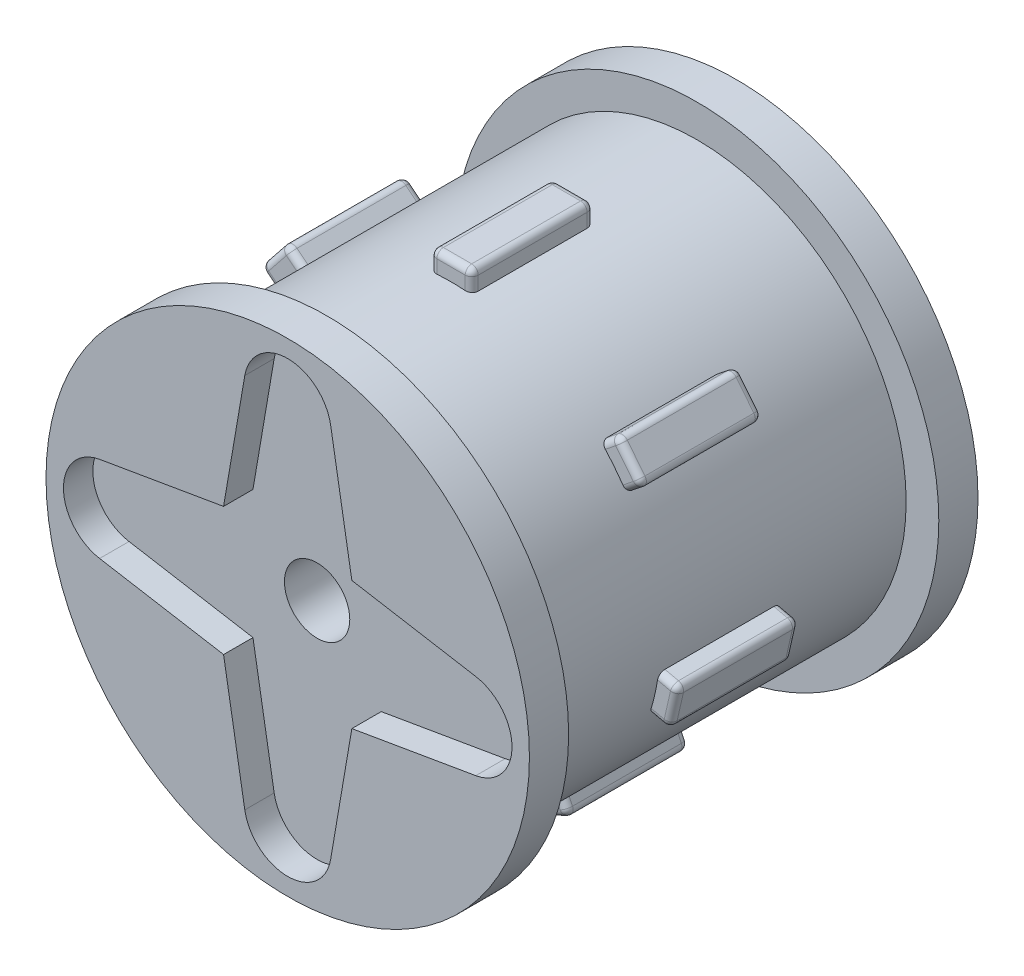
from build123d import *

# Parameters (mm, degrees)
AUFSATZ_LINEAR_AUSTRAGEN1_DEPTH      = 10.3
AUFSATZ_LINEAR_AUSTRAGEN1_DEPTH_BACK = 10.3
SKIZZE1_R                            = 9.6
SKIZZE2_R                            = 11.1
AUFSATZ_LINEAR_AUSTRAGEN2_DEPTH      = 1.8
AUFSATZ_LINEAR_START                 = -1.8
SKIZZE3_R                            = 11.1
AUFSATZ_LINEAR_AUSTRAGEN3_DEPTH      = 1.8
SCHNITT_LINEAR_AUSTRAGEN1_DEPTH      = 1.35
KREISMUSTER1_COUNT                   = 4
SKIZZE9_R                            = 1.5
SCHNITT_LINEAR_AUSTRAGEN2_DEPTH      = 25.839132433
SKIZZE11_W                           = 1.9
SKIZZE11_H                           = 1.78
AUFSATZ_LINEAR_AUSTRAGEN4_DEPTH      = 2.8
KREISMUSTER2_COUNT                   = 7
VERRUNDUNG1_R                        = 0.3


with BuildPart() as part:
    # Skizze1 → Aufsatz-Linear austragen1 (new, two sides: drawn at the far end of the back side and taken through both)
    with BuildSketch(Plane.XY.offset(-AUFSATZ_LINEAR_AUSTRAGEN1_DEPTH_BACK)):
        Circle(SKIZZE1_R)
    extrude(amount=AUFSATZ_LINEAR_AUSTRAGEN1_DEPTH + AUFSATZ_LINEAR_AUSTRAGEN1_DEPTH_BACK)

    # Skizze2 → Aufsatz-Linear austragen2 (add)
    with BuildSketch(Plane.XY.offset(10.3)):
        Circle(SKIZZE2_R)
    extrude(amount=-AUFSATZ_LINEAR_AUSTRAGEN2_DEPTH)

    # Skizze3 → Aufsatz-Linear austragen3 (add)
    with BuildSketch(Plane(origin=(0, 0, -10.3), x_dir=(-1, 0, 0), z_dir=(0, 0, -1)).offset(AUFSATZ_LINEAR_START)):
        Circle(SKIZZE3_R)
    extrude(amount=AUFSATZ_LINEAR_AUSTRAGEN3_DEPTH)

    # Skizze4 → Schnitt-Linear austragen1 (cut)
    with BuildSketch(Plane.XY.offset(10.3)):
        with BuildLine():
            Line((-1.971343548, 8.637349398), (-3.351284031, 0.573493976))
            ThreePointArc((-3.351284031, 0.573493976), (0, -3.4), (3.351284031, 0.573493976))
            Line((3.351284031, 0.573493976), (1.971343548, 8.637349398))
            ThreePointArc((1.971343548, 8.637349398), (0, 10.3), (-1.971343548, 8.637349398))
        make_face()
    schnitt_linear_austragen1 = extrude(amount=-SCHNITT_LINEAR_AUSTRAGEN1_DEPTH, mode=Mode.SUBTRACT)

    # Kreismuster1: Schnitt-Linear austragen1 ×4 about axis
    kreismuster1_axis = Axis((0, 0, -10.3), (0, 0, 1))
    for i in range(1, KREISMUSTER1_COUNT):
        add(schnitt_linear_austragen1.rotate(kreismuster1_axis, i * 360 / KREISMUSTER1_COUNT), mode=Mode.SUBTRACT)

    # Skizze8 → Schnitt-Rotation1 (revolve, cut)
    with BuildSketch(Plane(origin=(0, 0, 0), x_dir=(0, 0, -1), z_dir=(1, 0, 0))):
        Polygon((10.3, 0), (10.3, 8), (8.5, 8), (-6.45, 3.5), (-6.45, 0), align=None)
    revolve(axis=Axis((0, 0, -10.3), (0, 0, 1)), mode=Mode.SUBTRACT)

    # Skizze9 → Schnitt-Linear austragen2 (cut, through all)
    with BuildSketch(Plane.XY.offset(8.95)):
        Circle(SKIZZE9_R)
    extrude(amount=-SCHNITT_LINEAR_AUSTRAGEN2_DEPTH, mode=Mode.SUBTRACT)

    # Skizze11 → Aufsatz-Linear austragen4 (add, symmetric)
    with BuildSketch(Plane(origin=(0, 0, 0), x_dir=(-1, 0, 0), z_dir=(0, 0, -1))):
        with Locations((0, 9.6)):
            Rectangle(SKIZZE11_W, SKIZZE11_H)
    aufsatz_linear_austragen4 = extrude(amount=AUFSATZ_LINEAR_AUSTRAGEN4_DEPTH, both=True)

    # Kreismuster2: Aufsatz-Linear austragen4 ×7 about axis
    kreismuster2_axis = Axis((0, 0, -10.3), (0, 0, 1))
    for i in range(1, KREISMUSTER2_COUNT):
        add(aufsatz_linear_austragen4.rotate(kreismuster2_axis, i * 360 / KREISMUSTER2_COUNT))

    # Verrundung1
    verrundung1_edges = [part.edges().sort_by_distance(p)[0] for p in [
        (8.201412251, 6.540408021, 2.8),
        (7.609096939, 7.28314793, 0),
        (8.201412251, 6.540408021, -2.8),
        (8.793727563, 5.797668113, 0),
        (-8.42739227, 5.505525466, 2.8),
        (-7.242761647, 6.991005282, 2.8),
        (-7.242761647, 6.991005282, -2.8),
        (-8.42739227, 5.505525466, -2.8),
        (-9.558786273, -3.15616161, -2.8),
        (-9.981576048, -1.303798577, -2.8),
        (-9.558786273, -3.15616161, 2.8),
        (-9.981576048, -1.303798577, 2.8),
        (-5.204060098, -8.616815515, -2.8),
        (-3.492219249, -9.44119462, -2.8),
        (-3.492219249, -9.44119462, 2.8),
        (-5.204060098, -8.616815515, 2.8),
        (5.204060098, -8.616815515, 2.8),
        (3.492219249, -9.44119462, 2.8),
        (3.492219249, -9.44119462, -2.8),
        (5.204060098, -8.616815515, -2.8),
        (9.558786273, -3.15616161, 2.8),
        (9.558786273, -3.15616161, -2.8),
        (9.981576048, -1.303798577, 2.8),
        (9.981576048, -1.303798577, -2.8),
        (8.42739227, 5.505525466, 2.8),
        (8.42739227, 5.505525466, -2.8),
        (7.242761647, 6.991005282, -2.8),
        (7.242761647, 6.991005282, 2.8),
        (0.95, 10.021439574, 2.8),
        (0.95, 10.021439574, -2.8),
        (-0.95, 10.021439574, -2.8),
        (-0.95, 10.021439574, 2.8),
        (10.438388686, -1.408063081, 0),
        (10.226993799, -2.334244597, 2.8),
        (10.226993799, -2.334244597, -2.8),
        (10.015598912, -3.260426114, 0),
        (4.551440423, -9.451163424, 2.8),
        (4.551440423, -9.451163424, -2.8),
        (5.407360848, -9.038973872, 0),
        (3.695519999, -9.863352976, 0),
        (-4.551440423, -9.451163424, 2.8),
        (-4.551440423, -9.451163424, -2.8),
        (-5.407360848, -9.038973872, 0),
        (-3.695519999, -9.863352976, 0),
        (-10.226993799, -2.334244597, 2.8),
        (-10.226993799, -2.334244597, -2.8),
        (-10.015598912, -3.260426114, 0),
        (-10.438388686, -1.408063081, 0),
        (-8.201412251, 6.540408021, -2.8),
        (-8.201412251, 6.540408021, 2.8),
        (-8.793727563, 5.797668113, 0),
        (-7.609096939, 7.28314793, 0),
        (0, 10.49, -2.8),
        (0, 10.49, 2.8),
        (0.95, 10.49, 0),
        (-0.95, 10.49, 0),
    ]]
    fillet(verrundung1_edges, radius=VERRUNDUNG1_R)


solid = part.part
